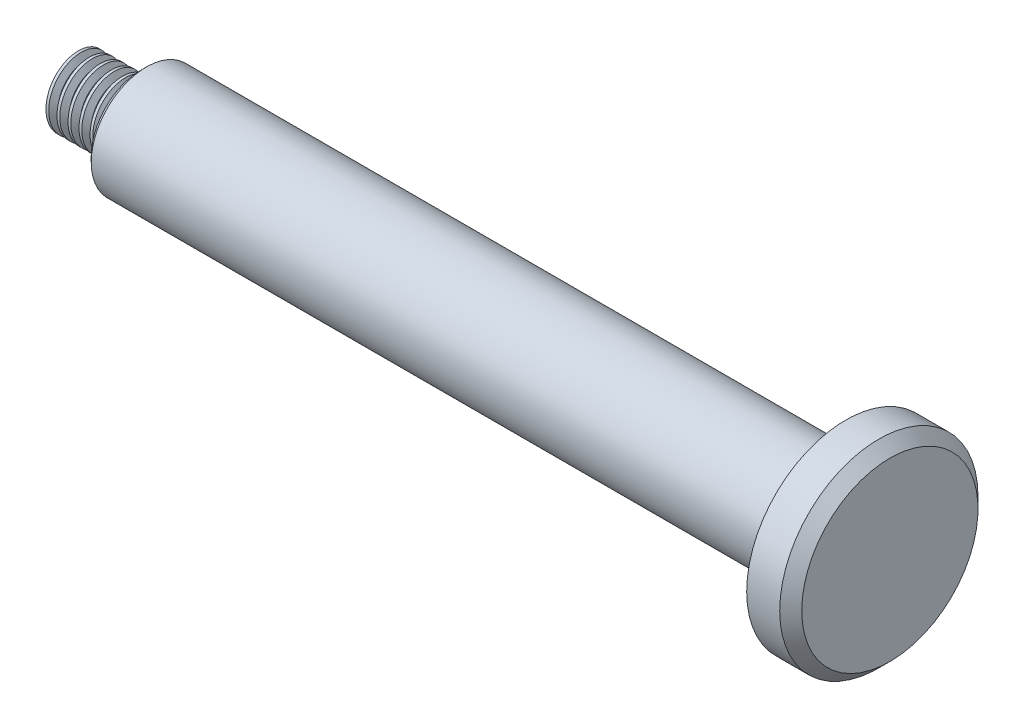
from build123d import *

# Parameters (mm, degrees)
FILLET1_R     = 0.5
THREAD1_PITCH = 1


with BuildPart() as part:
    # Sketch2 → Revolve1 (revolve)
    with BuildSketch(Plane.XY, mode=Mode.PRIVATE) as revolve1_sk:
        Polygon((0, 0), (74, 0), (74, 8), (73, 9), (70, 9), (70, 5), (6.5, 5), (6, 4.5), (6, 2.5), (0, 2.5), align=None)
    revolve(revolve1_sk.sketch.rotate(Axis((0, 0, 0), (1, 0, 0)), 90), axis=Axis((0, 0, 0), (1, 0, 0)))

    # Fillet1
    fillet1_edges = [part.edges().sort_by_distance(p)[0] for p in [
        (70, 0, -5),
    ]]
    fillet(fillet1_edges, radius=FILLET1_R)

    # Thread1: the profile of Thread Profile1 profile screwed along a right-hand helix of 7 turns, 8 arcs to a turn; built about Z, then put on its axis
    thread1_z = Axis((0, 0, 0), (0, 0, 1))
    thread1_corners = [(2.4997, 0, -0.000173205), (2.4997, 0, 0.875173202), (3.041265875, 0, 0.562499999), (3.041265875, 0, 0.312499999)]
    with BuildLine(mode=Mode.PRIVATE) as thread1_profile:
        Line(thread1_corners[0], thread1_corners[1])
        Line(thread1_corners[1], thread1_corners[2])
        Line(thread1_corners[2], thread1_corners[3])
        Line(thread1_corners[3], thread1_corners[0])
    thread1_cap = Face(thread1_profile.wire())
    thread1_turn_angles = [0, 22.5, 45, 67.5, 90, 112.5, 135, 157.5, 180, 202.5, 225, 247.5, 270, 292.5, 315, 337.5, 360]
    thread1_turn_weights = [1, 0.9238795325112867, 1, 0.9238795325112867, 1, 0.9238795325112867, 1, 0.9238795325112867, 1, 0.9238795325112867, 1, 0.9238795325112867, 1, 0.9238795325112867, 1, 0.9238795325112867, 1]
    thread1_turn_rails = [Edge.make_bspline([Vector(p[0], p[1], 0).rotate(thread1_z, thread1_turn_angles[k]) / thread1_turn_weights[k] + Vector(0, 0, p[2] + THREAD1_PITCH * thread1_turn_angles[k] / 360) for k in range(17)], [0, 0, 0, 1, 1, 2, 2, 3, 3, 4, 4, 5, 5, 6, 6, 7, 7, 8, 8, 8], 2, thread1_turn_weights) for p in thread1_corners]
    thread1_turn_sides = [Face.make_surface_from_curves(thread1_turn_rails[p[0]], thread1_turn_rails[p[1]]) for p in [(0, 1), (1, 2), (2, 3), (3, 0)]]
    thread1 = Plane(origin=(7, 0, 0), x_dir=(0, 0, 1), z_dir=(-1, 0, 0)) * Solid(Shell([*[p.moved(Location((0, 0, THREAD1_PITCH * i))) for i in range(7) for p in thread1_turn_sides], thread1_cap, thread1_cap.rotate(thread1_z, 2520).moved(Location((0, 0, THREAD1_PITCH * 2520 / 360)))]))
    add(thread1)

    # SurfaceCut1
    split(bisect_by=Plane(origin=(0, 0, 0), x_dir=(0, 0, -1), z_dir=(1, 0, 0)), keep=Keep.TOP)


solid = part.part
